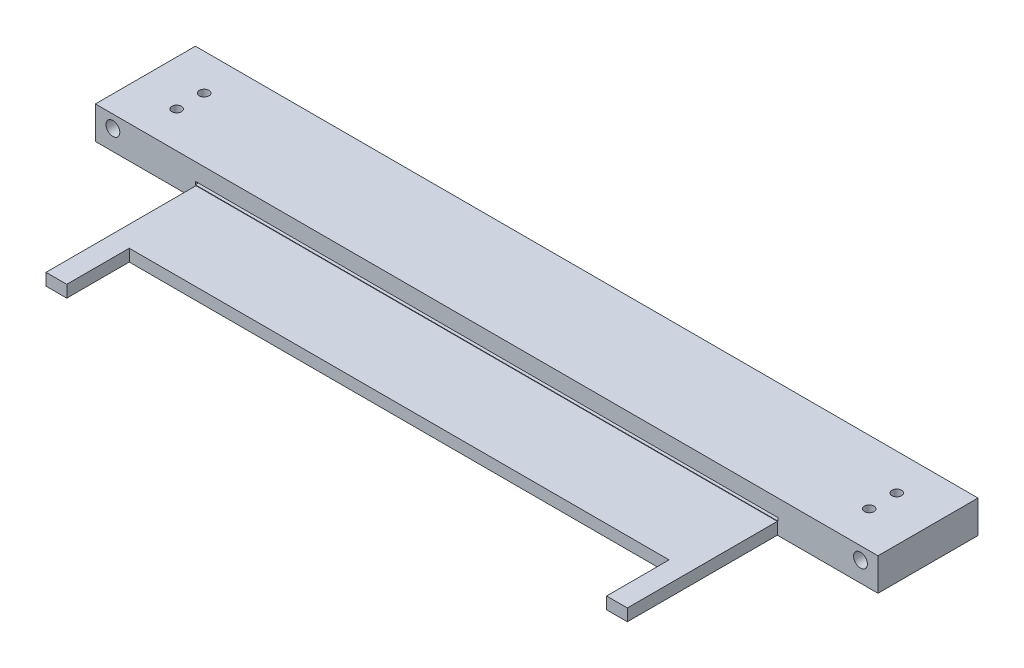
from build123d import *

# Parameters (mm, degrees)
SKETCH1_W           = 40
SKETCH1_H           = 10
BOSS_EXTRUDE1_DEPTH = 312.997959
SKETCH2_W           = 232.99
SKETCH2_H           = 1.2
CUT_EXTRUDE1_DEPTH  = 316.701951749
SKETCH3_R           = 1.9177
CUT_EXTRUDE2_DEPTH  = 316.701951749
CUT_EXTRUDE3_DEPTH  = 4.3
SKETCH5_R           = 2.762258299
CUT_EXTRUDE4_DEPTH  = 316.701951749
SKETCH6_W           = 3.15468
SKETCH6_H           = 6.8326
CUT_EXTRUDE5_DEPTH  = 15
SKETCH7_W           = 232.5
SKETCH7_H           = 1.800950688
BOSS_EXTRUDE2_DEPTH = 60
CUT_EXTRUDE6_REACH  = 320.802
SKETCH8_W           = 215.9
SKETCH8_H           = 25
BOSS_EXTRUDE3_DEPTH = 3


with BuildPart() as part:
    # Sketch1 → Boss-Extrude1 (new body)
    with BuildSketch(Plane(origin=(0, 0, 0), x_dir=(0, 0, -1), z_dir=(1, 0, 0))):
        with Locations((20, 5)):
            Rectangle(SKETCH1_W, SKETCH1_H)
    extrude(amount=BOSS_EXTRUDE1_DEPTH)

    # Sketch2 → Cut-Extrude1 (cut, through all)
    with BuildSketch(Plane(origin=(0, 0, -40), x_dir=(-1, 0, 0), z_dir=(0, 0, -1))):
        with Locations((-156.4989795, 2.6)):
            Rectangle(SKETCH2_W, SKETCH2_H)
    extrude(amount=-CUT_EXTRUDE1_DEPTH, mode=Mode.SUBTRACT)

    # Sketch3 → Cut-Extrude2 (cut, through all)
    with BuildSketch(Plane(origin=(0, 10, 0), x_dir=(1, 0, 0), z_dir=(0, 1, 0))):
        with Locations((294.997959, 25.5)):
            Circle(SKETCH3_R)
        with Locations((294.997959, 14.5)):
            Circle(SKETCH3_R)
        with Locations((18, 14.5)):
            Circle(SKETCH3_R)
        with Locations((18, 25.5)):
            Circle(SKETCH3_R)
    extrude(amount=-CUT_EXTRUDE2_DEPTH, mode=Mode.SUBTRACT)

    # Sketch4 → Cut-Extrude3 (cut)
    with BuildSketch(Plane.XZ):
        Polygon((14.5837, -12.527598275), (14.5837, -16.472401725), (18, -18.444803449), (21.4163, -16.472401725), (21.4163, -12.527598275), (18, -10.555196551), align=None)
        Polygon((14.5837, -23.527598275), (14.5837, -27.472401725), (18, -29.444803449), (21.4163, -27.472401725), (21.4163, -23.527598275), (18, -21.555196551), align=None)
        Polygon((298.414259, -12.527598275), (294.997959, -10.555196551), (291.581659, -12.527598275), (291.581659, -16.472401725), (294.997959, -18.444803449), (298.414259, -16.472401725), align=None)
        Polygon((291.581659, -23.527598275), (291.581659, -27.472401725), (294.997959, -29.444803449), (298.414259, -27.472401725), (298.414259, -23.527598275), (294.997959, -21.555196551), align=None)
    extrude(amount=-CUT_EXTRUDE3_DEPTH, mode=Mode.SUBTRACT)

    # Sketch5 → Cut-Extrude4 (cut, through all)
    with BuildSketch(Plane.XY):
        with Locations((7, 5)):
            Circle(SKETCH5_R)
        with Locations((305.997959, 5)):
            Circle(SKETCH5_R)
    extrude(amount=-CUT_EXTRUDE4_DEPTH, mode=Mode.SUBTRACT)

    # Sketch6 → Cut-Extrude5 (cut)
    with BuildSketch(Plane.ZY):
        with Locations((-31.42266, 5)):
            Rectangle(SKETCH6_W, SKETCH6_H)
        with Locations((-8.57734, 5)):
            Rectangle(SKETCH6_W, SKETCH6_H)
    extrude(amount=-CUT_EXTRUDE5_DEPTH, mode=Mode.SUBTRACT)

    # Sketch7 → Boss-Extrude2 (add)
    with BuildSketch(Plane.XY):
        with Locations((156.4989795, 0.900475344)):
            Rectangle(SKETCH7_W, SKETCH7_H)
    extrude(amount=BOSS_EXTRUDE2_DEPTH)

    # Sketch8 → Cut-Extrude6 (cut, up to next)
    with BuildSketch(Plane(origin=(0, 1.800950688, 0), x_dir=(1, 0, 0), z_dir=(0, 1, 0)), mode=Mode.PRIVATE) as cut_extrude6_sk1:
        with Locations((156.4989795, -47.5)):
            Rectangle(SKETCH8_W, SKETCH8_H)
    cut_extrude6_tool1 = extrude(cut_extrude6_sk1.sketch, amount=-CUT_EXTRUDE6_REACH, mode=Mode.PRIVATE) & part.part
    add(cut_extrude6_tool1.solids().sort_by_distance((156.49898, 1.800951, 47.5))[0], mode=Mode.SUBTRACT)

    # Sketch9 → Boss-Extrude3 (add)
    with BuildSketch(Plane.XZ):
        Polygon((0, -40), (0, 0), (40.2489795, 0), (40.2489795, 60), (48.5489795, 60), (48.5489795, 35), (264.4489795, 35), (264.4489795, 60), (272.7489795, 60), (272.7489795, 0), (312.997959, 0), (312.997959, -40), align=None)
        Polygon((17.997668231, -10.55519724), (14.582534712, -12.529617991), (14.584866481, -16.474420751), (18.002331769, -18.44480276), (21.417465288, -16.470382009), (21.415133519, -12.525579249), align=None, mode=Mode.SUBTRACT)
        Polygon((18.002331769, -21.55519724), (14.584866481, -23.525579249), (14.582534712, -27.470382009), (17.997668231, -29.44480276), (21.415133519, -27.474420751), (21.417465288, -23.529617991), align=None, mode=Mode.SUBTRACT)
        Polygon((295.000290769, -10.55519724), (291.582825481, -12.525579249), (291.580493712, -16.470382009), (294.995627231, -18.44480276), (298.413092519, -16.474420751), (298.415424288, -12.529617991), align=None, mode=Mode.SUBTRACT)
        Polygon((294.995627231, -21.55519724), (291.580493712, -23.529617991), (291.582825481, -27.474420751), (295.000290769, -29.44480276), (298.415424288, -27.470382009), (298.413092519, -23.525579249), align=None, mode=Mode.SUBTRACT)
    extrude(amount=BOSS_EXTRUDE3_DEPTH)


solid = part.part
